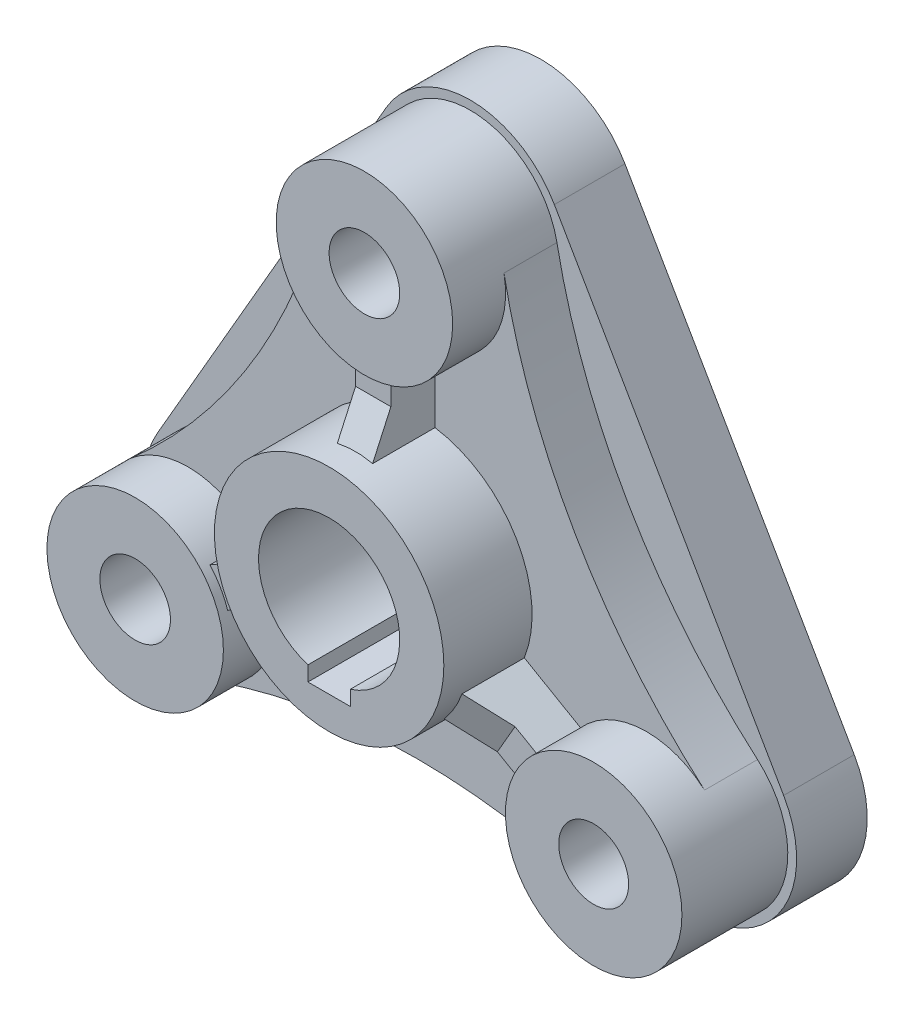
from build123d import *

# Parameters (mm, degrees)
BOSS_EXTRUDE2_DEPTH     = 15
SKETCH1_6_R             = 25
BOSS_EXTRUDE3_DEPTH     = 30
SKETCH1_7_R             = 32.5
BOSS_EXTRUDE4_DEPTH     = 40
BOSS_EXTRUDE5_DEPTH     = 20
SHELL1_T                = -5
RIB1_START              = -5
RIB1_DEPTH              = 10
CIRPATTERN1_COUNT       = 3
CUT_EXTRUDE1_DEPTH      = 144.713620755
CUT_EXTRUDE1_DEPTH_BACK = 144.713620755
SKETCH1_8_R             = 10
SKETCH1_8_R_2           = 9.896657658
KEYWAY_DEPTH            = 161.809545085


# Read off the part's stored shape, not the designer's step: Rib1
with BuildPart() as part:
    # Sketch1 → Boss-Extrude2 (new body)
    with BuildSketch(Plane.XY):
        with BuildLine():
            ThreePointArc((24.536591615, 79.791207774), (0, 100), (-24.536591615, 79.791207774))
            ThreePointArc((-24.536591615, 79.791207774), (-44.738287256, 25.82966219), (-81.369508738, -18.646292226))
            ThreePointArc((-81.369508738, -18.646292226), (-86.602540378, -50), (-56.832917123, -61.144915548))
            ThreePointArc((-56.832917123, -61.144915548), (0, -51.65932438), (56.832917123, -61.144915548))
            ThreePointArc((56.832917123, -61.144915548), (86.602540378, -50), (81.369508738, -18.646292226))
            ThreePointArc((81.369508738, -18.646292226), (44.738287256, 25.82966219), (24.536591615, 79.791207774))
        make_face()
    extrude(amount=BOSS_EXTRUDE2_DEPTH)

    # Sketch1<6> → Boss-Extrude3 (add)
    with BuildSketch(Plane.XY):
        with Locations(Location((0, 75, 0), (0, 0, 168.951006611))):
            Circle(SKETCH1_6_R)
        with Locations(Location((64.951905284, -37.5, 0), (0, 0, 251.048993389))):
            Circle(SKETCH1_6_R)
        with Locations(Location((-64.951905284, -37.5, 0), (0, 0, 131.048993389))):
            Circle(SKETCH1_6_R)
    extrude(amount=BOSS_EXTRUDE3_DEPTH)

    # Sketch1<7> → Boss-Extrude4 (add)
    with BuildSketch(Plane.XY):
        Circle(SKETCH1_7_R)
    extrude(amount=BOSS_EXTRUDE4_DEPTH)


with BuildPart() as body_2:
    # Sketch2 → Boss-Extrude5 (new body)
    with BuildSketch(Plane(origin=(0, 0, 0), x_dir=(-1, 0, 0), z_dir=(0, 0, -1))):
        with BuildLine():
            Line((-88.767603888, -23.75), (-23.815698604, 88.75))
            ThreePointArc((-23.815698604, 88.75), (0, 102.5), (23.815698604, 88.75))
            Line((23.815698604, 88.75), (88.767603888, -23.75))
            ThreePointArc((88.767603888, -23.75), (88.767603888, -51.25), (64.951905284, -65))
            Line((64.951905284, -65), (-64.951905284, -65))
            ThreePointArc((-64.951905284, -65), (-88.767603888, -51.25), (-88.767603888, -23.75))
        make_face()
    extrude(amount=BOSS_EXTRUDE5_DEPTH)

    # Shell1
    shell1_openings = [body_2.faces().sort_by_distance(p)[0] for p in [
        (0, 0, -20),
    ]]
    offset(amount=SHELL1_T, openings=shell1_openings, kind=Kind.INTERSECTION)

    # Combine1: union part
    add(part.part)

    # Rib1 outline → Rib1 (add)
    with BuildSketch(Plane(origin=(0, 0, 0), x_dir=(0, 0, -1), z_dir=(1, 0, 0)).offset(RIB1_START)):
        Polygon((-27.5, 52), (-27.5, 43.5), (-32.67587207, 32.113081447), (-33.181818182, 31), (-15, 31), (-15, 52), align=None)
    rib1 = extrude(amount=RIB1_DEPTH)

    # CirPattern1: Rib1 ×3 about axis
    cirpattern1_axis = Axis((0, 0, 0), (0, 0, 1))
    for i in range(1, CIRPATTERN1_COUNT):
        add(rib1.rotate(cirpattern1_axis, i * 360 / CIRPATTERN1_COUNT))

    # Sketch1<8> → Cut-Extrude1 (cut, two sides: drawn at the far end of the back side and taken through both)
    with BuildSketch(Plane.XY.offset(-CUT_EXTRUDE1_DEPTH_BACK)):
        with Locations((0, 75)):
            Circle(SKETCH1_8_R)
        with Locations((-64.951905284, -37.5)):
            Circle(SKETCH1_8_R)
        with Locations((64.951905284, -37.5)):
            Circle(SKETCH1_8_R_2)
    extrude(amount=CUT_EXTRUDE1_DEPTH + CUT_EXTRUDE1_DEPTH_BACK, mode=Mode.SUBTRACT)

    # KeySketch → Keyway (cut, through all)
    with BuildSketch(Plane(origin=(-6.035211163, -9.571395477, 40), x_dir=(1, 0, 0), z_dir=(0, 0, 1))):
        with BuildLine():
            Line((12.035211163, -9.507388551), (12.035211163, -13.728604523))
            Line((12.035211163, -13.728604523), (0.035211163, -13.728604523))
            Line((0.035211163, -13.728604523), (0.035211163, -9.507388551))
            ThreePointArc((0.035211163, -9.507388551), (6.035211163, 29.571395477), (12.035211163, -9.507388551))
        make_face()
    extrude(amount=-KEYWAY_DEPTH, mode=Mode.SUBTRACT)


solid = body_2.part
